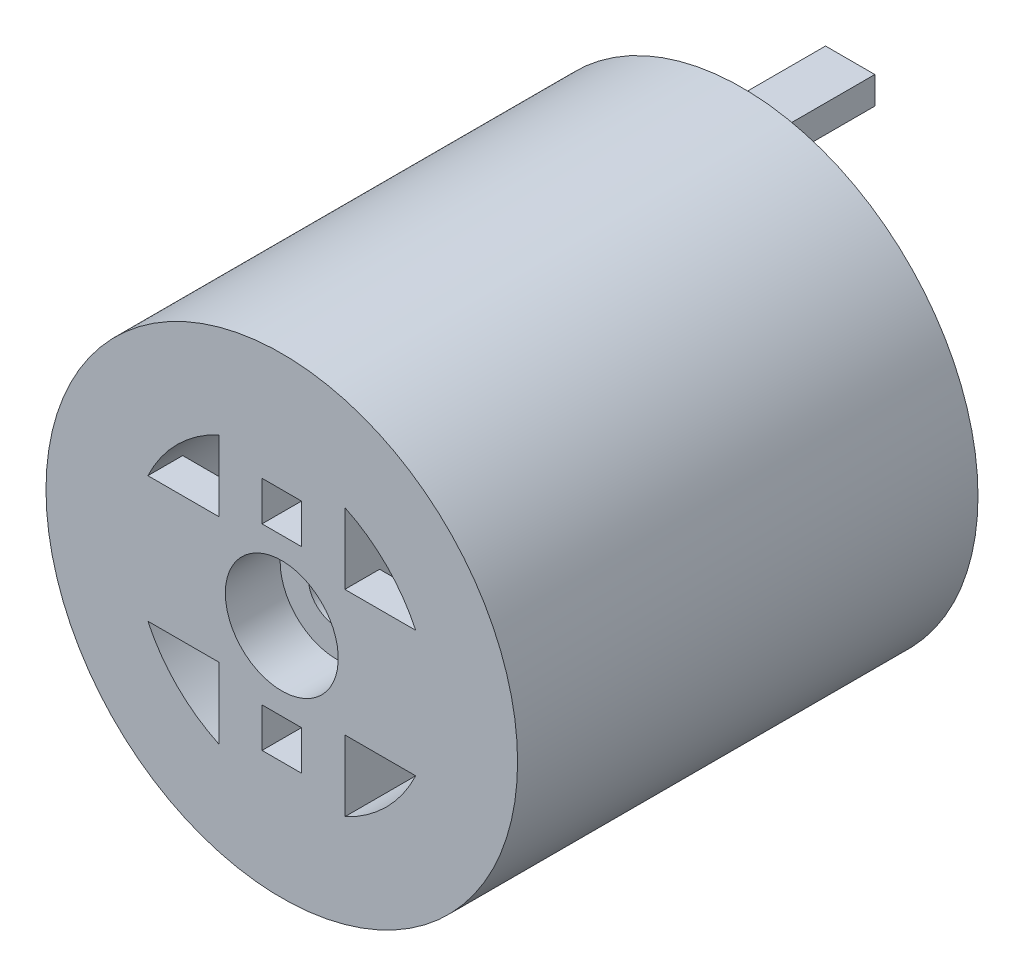
from build123d import *

# Parameters (mm, degrees)
SKETCH1_R                       = 21.51
BOSS_EXTRUDE1_DEPTH             = 42
SKETCH1_4_W                     = 4.5
SKETCH1_4_H                     = 2.5
BOSS_EXTRUDE2_DEPTH             = 9.85
CIRPATTERN2_COUNT               = 2
BOSS_EXTRUDE3_DEPTH             = 3.175
SKETCH8_W                       = 11.49524473
SKETCH8_H                       = 32.96460859
SKETCH8_R                       = 2.5875
BOSS_EXTRUDE4_DEPTH             = 5
CUT_EXTRUDE1_DEPTH              = 23
CIRPATTERN1_COUNT               = 2
CIRPATTERN1_ANGLE               = 53
CIRPATTERN1_THE_OTHER_WAY_COUNT = 2
CIRPATTERN1_THE_OTHER_WAY_ANGLE = 53
MIRROR2_COPY_1_DEPTH            = 23
MIRROR2_COPY_2_DEPTH            = 23
MIRROR2_COPY_3_DEPTH            = 23
CUT_EXTRUDE2_DEPTH              = 61.114746111
CUT_EXTRUDE2_DEPTH_BACK         = 5
SKETCH7_R                       = 5.15
CUT_EXTRUDE21_DEPTH             = 29


with BuildPart() as part:
    # Sketch1 → Boss-Extrude1 (new body)
    with BuildSketch(Plane.XY):
        Circle(SKETCH1_R)
        with BuildLine():
            ThreePointArc((0, 13.500344823), (9.546185373, 9.546185373), (13.500344823, 0))
            ThreePointArc((13.500344823, 0), (9.546185373, -9.546185373), (0, -13.500344823))
            ThreePointArc((0, -13.500344823), (-13.500344823, 0), (0, 13.500344823))
        make_face(mode=Mode.SUBTRACT)
    extrude(amount=BOSS_EXTRUDE1_DEPTH)

    # Sketch1<4> → Boss-Extrude2 (add)
    with BuildSketch(Plane.XY):
        with Locations((0, 17.500344823)):
            Rectangle(SKETCH1_4_W, SKETCH1_4_H)
    boss_extrude2 = extrude(amount=-BOSS_EXTRUDE2_DEPTH)

    # CirPattern2: Boss-Extrude2 ×2 about axis
    cirpattern2_axis = Axis((0, 0, 26.501422175), (0, 0, -1))
    for i in range(1, CIRPATTERN2_COUNT):
        add(boss_extrude2.rotate(cirpattern2_axis, i * 360 / CIRPATTERN2_COUNT))

    # Sketch4 → Boss-Extrude3 (add)
    with BuildSketch(Plane.XY.offset(42)):
        Polygon((-5.747622365, -18.82107696), (5.747622365, -18.82107696), (5.747622365, -5.747622365), (18.82107696, -5.747622365), (18.82107696, 5.747622365), (5.747622365, 5.747622365), (5.747622365, 18.82107696), (-5.747622365, 18.82107696), (-5.747622365, 5.747622365), (-18.82107696, 5.747622365), (-18.82107696, -5.747622365), (-5.747622365, -5.747622365), align=None)
    extrude(amount=-BOSS_EXTRUDE3_DEPTH)

    # Sketch8 → Boss-Extrude4 (add)
    with BuildSketch(Plane.XY.offset(38.825)):
        Rectangle(SKETCH8_W, SKETCH8_H)
        Circle(SKETCH8_R, mode=Mode.SUBTRACT)
    extrude(amount=-BOSS_EXTRUDE4_DEPTH)

    # Sketch1<3> → Cut-Extrude1 (cut)
    with BuildSketch(Plane.XY):
        Polygon((14.534826762, 4.999881098), (14.500344823, 0), (14.465862885, -4.999881098), (19.465743983, -5.034363037), (19.53470786, 4.96539916), align=None)
    cut_extrude1 = extrude(amount=CUT_EXTRUDE1_DEPTH, mode=Mode.SUBTRACT)

    # CirPattern1: Cut-Extrude1 ×2 about axis
    cirpattern1_axis = Axis((0, 0, 26.501422175), (0, 0, 1))
    for i in range(1, CIRPATTERN1_COUNT):
        add(cut_extrude1.rotate(cirpattern1_axis, i * CIRPATTERN1_ANGLE / (CIRPATTERN1_COUNT - 1)), mode=Mode.SUBTRACT)

    # CirPattern1 the other way: Cut-Extrude1 ×2 about axis
    cirpattern1_the_other_way_axis = Axis((0, 0, 26.501422175), (0, 0, -1))
    for i in range(1, CIRPATTERN1_THE_OTHER_WAY_COUNT):
        add(cut_extrude1.rotate(cirpattern1_the_other_way_axis, i * CIRPATTERN1_THE_OTHER_WAY_ANGLE / (CIRPATTERN1_THE_OTHER_WAY_COUNT - 1)), mode=Mode.SUBTRACT)

    # Mirror2 copy 1 sketch → Mirror2 copy 1 (cut)
    with BuildSketch(Plane(origin=(0, 0, 0), x_dir=(-0.6018150231520466, 0.798635510047294, 0), z_dir=(0, 0, 1))):
        Polygon((14.534826762, -4.999881098), (14.500344823, 0), (14.465862885, 4.999881098), (19.465743983, 5.034363037), (19.53470786, -4.96539916), align=None)
    extrude(amount=MIRROR2_COPY_1_DEPTH, mode=Mode.SUBTRACT)

    # Mirror2 copy 2 sketch → Mirror2 copy 2 (cut)
    with BuildSketch(Plane(origin=(0, 0, 0), x_dir=(-0.6018150231520466, -0.798635510047294, 0), z_dir=(0, 0, 1))):
        Polygon((14.534826762, -4.999881098), (14.500344823, 0), (14.465862885, 4.999881098), (19.465743983, 5.034363037), (19.53470786, -4.96539916), align=None)
    extrude(amount=MIRROR2_COPY_2_DEPTH, mode=Mode.SUBTRACT)

    # Mirror2 copy 3 sketch → Mirror2 copy 3 (cut)
    with BuildSketch(Plane(origin=(0, 0, 0), x_dir=(-1, 0, 0), z_dir=(0, 0, 1))):
        Polygon((14.534826762, -4.999881098), (14.500344823, 0), (14.465862885, 4.999881098), (19.465743983, 5.034363037), (19.53470786, -4.96539916), align=None)
    extrude(amount=MIRROR2_COPY_3_DEPTH, mode=Mode.SUBTRACT)

    # Sketch7 → Cut-Extrude2 (cut, two sides: drawn at the far end of the back side and taken through both)
    with BuildSketch(Plane.XY.offset(42).offset(-CUT_EXTRUDE2_DEPTH_BACK)):
        Circle(SKETCH7_R)
    extrude(amount=CUT_EXTRUDE2_DEPTH + CUT_EXTRUDE2_DEPTH_BACK, mode=Mode.SUBTRACT)

    # Sketch11 → Cut-Extrude21 (cut)
    with BuildSketch(Plane(origin=(0, 0, 42), x_dir=(-1, 0, 0), z_dir=(0, 0, -1))):
        Polygon((1.8, 10.75), (-1.8, 10.75), (-1.8, 7.15), (0, 7.15), (1.8, 7.15), align=None)
    cut_extrude21 = extrude(amount=CUT_EXTRUDE21_DEPTH, mode=Mode.SUBTRACT)

    # Mirror1: Cut-Extrude21 across plane
    add(cut_extrude21.mirror(Plane.ZX), mode=Mode.SUBTRACT)


solid = part.part
